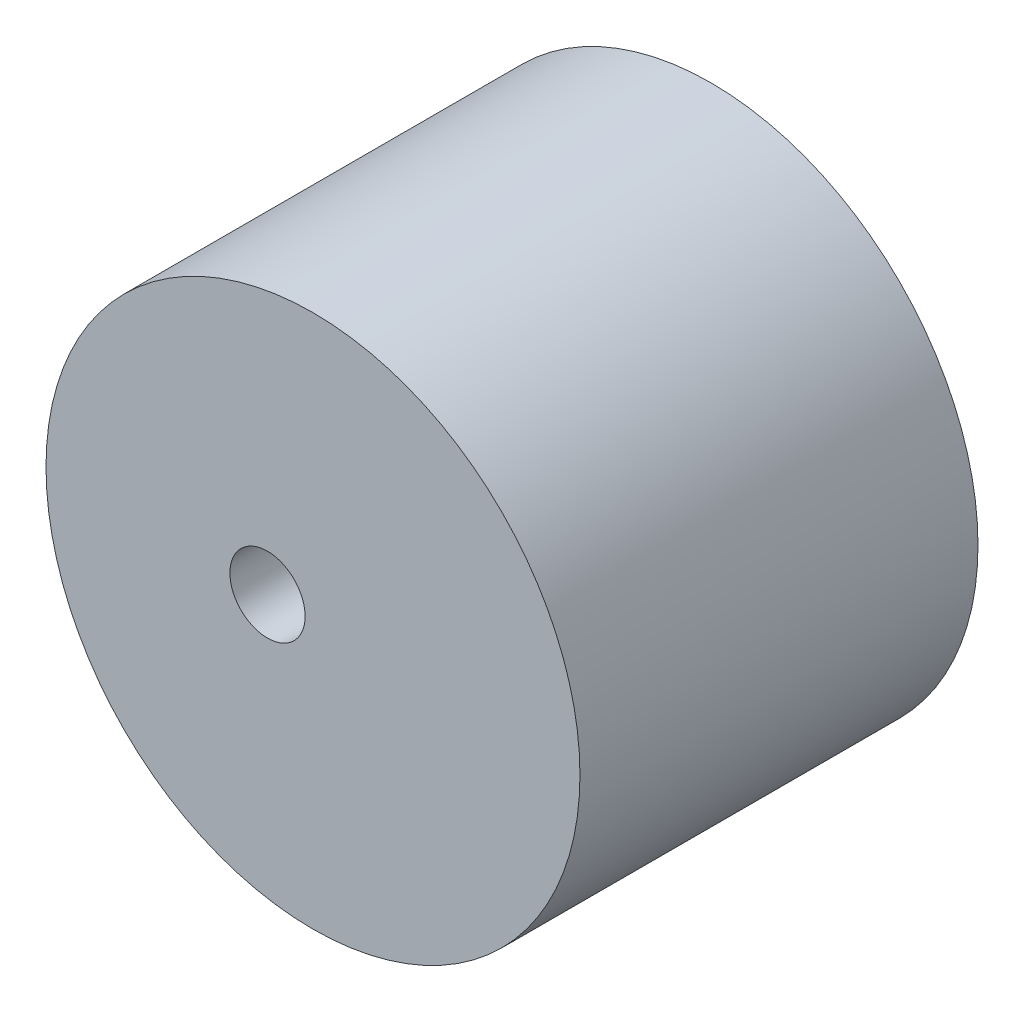
from build123d import *

# Parameters (mm, degrees)
SKETCH11_R           = 23.476875
SKETCH11_R_2         = 3.3085
BOSS_EXTRUDE13_DEPTH = 35


with BuildPart() as part:
    # Sketch11 → Boss-Extrude13 (new body)
    with BuildSketch(Plane.XY):
        Circle(SKETCH11_R)
        with Locations((-4, 0)):
            Circle(SKETCH11_R_2, mode=Mode.SUBTRACT)
    extrude(amount=BOSS_EXTRUDE13_DEPTH)


solid = part.part
